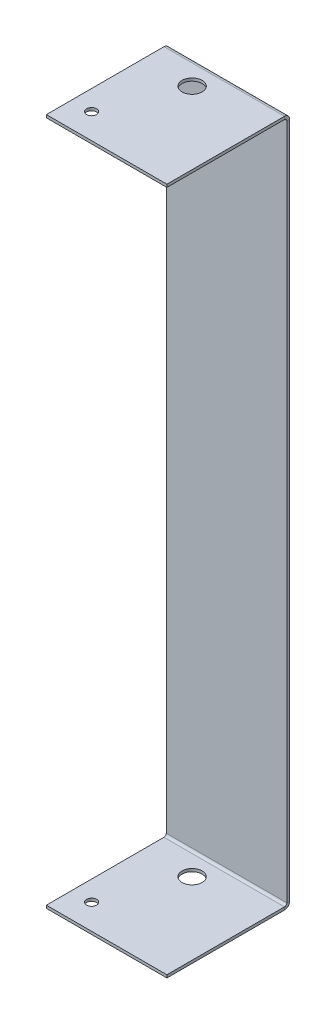
from build123d import *

# Parameters (mm, degrees)
SKETCH1_W                        = 38.1
SKETCH1_H                        = 292.1
BASE_FLANGE1_DEPTH               = 0.889
SKETCHED_START                   = -19.05
SKETCHED_BEND5_DEPTH             = 38.1
SKETCHED_BEND5_2_DEPTH           = 38.1
SKETCHED_BEND8_DEPTH             = 38.1
SKETCHED_BEND8_2_DEPTH           = 38.1
F_1_4_0_25_DIAMETER_HOLE4_D      = 6.35
F_1_4_0_25_DIAMETER_HOLE4_DEPTH  = 0.889
F_1_8_0_125_DIAMETER_HOLE1_D     = 3.175
F_1_8_0_125_DIAMETER_HOLE1_DEPTH = 0.889


# Read off the part's stored shape, not the designer's step: Sketched Bend5, Sketched Bend8
# Sheet-metal steps are written as plain solids
with BuildPart() as part:
    # Sketch1 → Base-Flange1 (new body)
    with BuildSketch(Plane.XY):
        Rectangle(SKETCH1_W, SKETCH1_H)
    extrude(amount=-BASE_FLANGE1_DEPTH)

    # Sketched Bend5 outline → Sketched Bend5 (cut)
    with BuildSketch(Plane.YZ.offset(SKETCHED_START)):
        with BuildLine():
            Line((146.05, 0), (108.471502454, 0))
            ThreePointArc((108.471502454, 0), (107.872412816, -0.64903926), (107.022366229, -0.889))
            Line((107.022366229, -0.889), (146.05, -0.889))
            Line((146.05, -0.889), (146.05, 0))
        make_face()
    extrude(amount=SKETCHED_BEND5_DEPTH, mode=Mode.SUBTRACT)

    # Sketched Bend5 2 outline → Sketched Bend5 2 (add)
    with BuildSketch(Plane.YZ.offset(SKETCHED_START)):
        with BuildLine():
            ThreePointArc((108.471502454, 0), (108.603234852, 0.357878789), (108.647966229, 0.7366))
            Line((108.647966229, 0.7366), (108.647966229, 37.908966229))
            Line((108.647966229, 37.908966229), (107.758966229, 37.908966229))
            Line((107.758966229, 37.908966229), (107.758966229, 0.7366))
            ThreePointArc((107.758966229, 0.7366), (107.543221084, 0.215745145), (107.022366229, 0))
            Line((107.022366229, 0), (108.471502454, 0))
        make_face()
    extrude(amount=SKETCHED_BEND5_2_DEPTH)

    # Sketched Bend8 outline → Sketched Bend8 (cut)
    with BuildSketch(Plane.YZ.offset(SKETCHED_START)):
        with BuildLine():
            ThreePointArc((-107.022366229, -0.889), (-107.872412816, -0.64903926), (-108.471502454, 0))
            Line((-108.471502454, 0), (-146.05, 0))
            Line((-146.05, 0), (-146.05, -0.889))
            Line((-146.05, -0.889), (-107.022366229, -0.889))
        make_face()
    extrude(amount=SKETCHED_BEND8_DEPTH, mode=Mode.SUBTRACT)

    # Sketched Bend8 2 outline → Sketched Bend8 2 (add)
    with BuildSketch(Plane.YZ.offset(SKETCHED_START)):
        with BuildLine():
            Line((-107.758966229, 0.7366), (-107.758966229, 37.908966229))
            Line((-107.758966229, 37.908966229), (-108.647966229, 37.908966229))
            Line((-108.647966229, 37.908966229), (-108.647966229, 0.7366))
            ThreePointArc((-108.647966229, 0.7366), (-108.603234852, 0.357878789), (-108.471502454, 0))
            Line((-108.471502454, 0), (-107.022366229, 0))
            ThreePointArc((-107.022366229, 0), (-107.543221084, 0.215745145), (-107.758966229, 0.7366))
        make_face()
    extrude(amount=SKETCHED_BEND8_2_DEPTH)

    # 1/4 (0.25) Diameter Hole4
    with Locations(Plane(origin=(-3.81, 107.758966229, 7.0866), x_dir=(0, 0, -1), z_dir=(0, -1, 0))):
        with Locations((0, 0)):
            f_1_4_0_25_diameter_hole4 = Hole(F_1_4_0_25_DIAMETER_HOLE4_D / 2, depth=F_1_4_0_25_DIAMETER_HOLE4_DEPTH)

    # 1/8 (0.125) Diameter Hole1
    with Locations(Plane(origin=(-12.7, 107.758966229, 29.9466), x_dir=(0, 0, -1), z_dir=(0, -1, 0))):
        with Locations((0, 0)):
            f_1_8_0_125_diameter_hole1 = Hole(F_1_8_0_125_DIAMETER_HOLE1_D / 2, depth=F_1_8_0_125_DIAMETER_HOLE1_DEPTH)

    # Mirror1: 1/4 (0.25) Diameter Hole4, 1/8 (0.125) Diameter Hole1 across plane
    add(f_1_4_0_25_diameter_hole4.mirror(Plane.ZX), mode=Mode.SUBTRACT)
    add(f_1_8_0_125_diameter_hole1.mirror(Plane.ZX), mode=Mode.SUBTRACT)


solid = part.part
